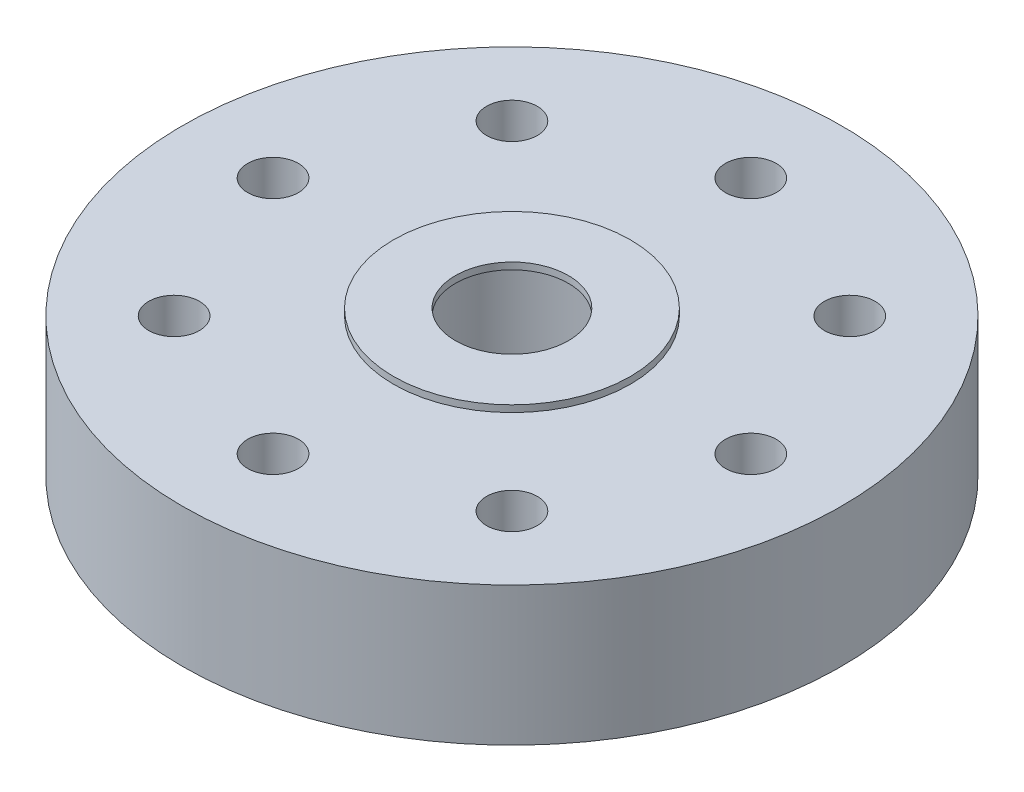
from build123d import *

# Parameters (mm, degrees)
SKETCH1_R        = 9.74
SKETCH1_R_2      = 2.57
MOUNTBODY_DEPTH  = 4.1
SKETCH2_R        = 3.5
SKETCH2_R_2      = 1.67
CAP_DEPTH        = 0.2
SKETCH3_R        = 0.75
SCREWHOLES_DEPTH = 15.371680486


with BuildPart() as part:
    # Sketch1 → MountBody (new body)
    with BuildSketch(Plane(origin=(0, 0, 0), x_dir=(1, 0, 0), z_dir=(0, 1, 0))):
        Circle(SKETCH1_R)
        Circle(SKETCH1_R_2, mode=Mode.SUBTRACT)
    extrude(amount=MOUNTBODY_DEPTH)

    # Sketch2 → Cap (add)
    with BuildSketch(Plane(origin=(0, 4.1, 0), x_dir=(1, 0, 0), z_dir=(0, 1, 0))):
        Circle(SKETCH2_R)
        Circle(SKETCH2_R_2, mode=Mode.SUBTRACT)
    extrude(amount=CAP_DEPTH)

    # Sketch3 → ScrewHoles (cut, through all)
    with BuildSketch(Plane(origin=(0, 4.1, 0), x_dir=(1, 0, 0), z_dir=(0, 1, 0))):
        with Locations((7.06, 0)):
            Circle(SKETCH3_R)
        with Locations((4.992173875, -4.992173875)):
            Circle(SKETCH3_R)
        with Locations((0, -7.06)):
            Circle(SKETCH3_R)
        with Locations((-4.992173875, -4.992173875)):
            Circle(SKETCH3_R)
        with Locations((-7.06, 0)):
            Circle(SKETCH3_R)
        with Locations((-4.992173875, 4.992173875)):
            Circle(SKETCH3_R)
        with Locations((0, 7.06)):
            Circle(SKETCH3_R)
        with Locations((4.992173875, 4.992173875)):
            Circle(SKETCH3_R)
    extrude(amount=-SCREWHOLES_DEPTH, mode=Mode.SUBTRACT)


solid = part.part
